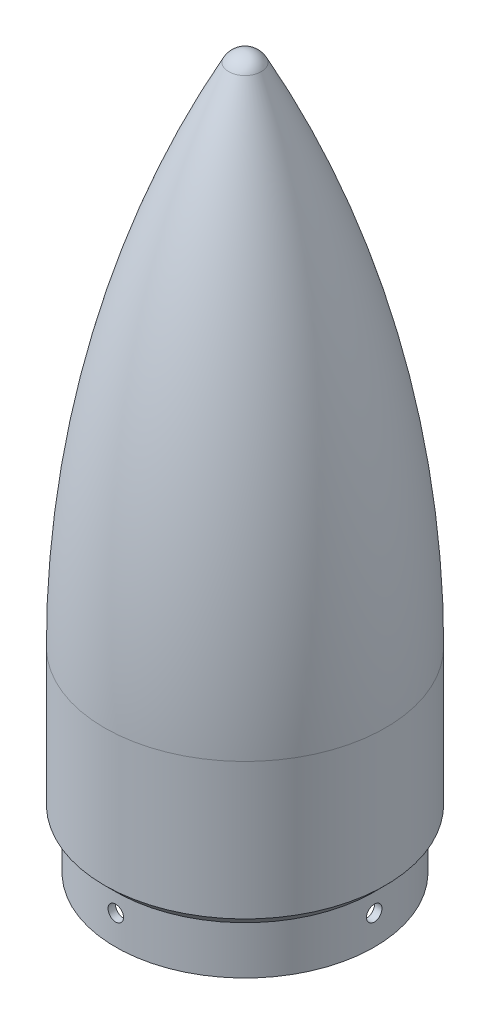
from build123d import *

# Parameters (mm, degrees)
SKETCH2_R           = 38.1
BOSS_EXTRUDE1_DEPTH = 40
SKETCH3_R           = 35.1
BOSS_EXTRUDE2_DEPTH = 13
CHAMFER1_SIZE       = 3
SKETCH4_R           = 2.1
CUT_EXTRUDE1_DEPTH  = 151.010733
CIRPATTERN1_COUNT   = 2
CIRPATTERN1_ANGLE   = 90


# Read off the part's stored shape, not the designer's step: Shell1
with BuildPart() as part:
    # Sketch1 → Revolve1 (revolve)
    with BuildSketch(Plane.XY, mode=Mode.PRIVATE) as revolve1_sk:
        with BuildLine():
            Line((0, 0), (-38.1, 0))
            ThreePointArc((-38.1, 0), (-29.56040295, 70.689958057), (-4.432931983, 137.312815175))
            ThreePointArc((-4.432931983, 137.312815175), (-2.591903174, 139.275749985), (0, 140))
            Line((0, 140), (0, 0))
        make_face()
    revolve(revolve1_sk.sketch.rotate(Axis((0, 140, 0), (0, -1, 0)), 270), axis=Axis((0, 140, 0), (0, -1, 0)))

    # Sketch2 → Boss-Extrude1 (add)
    with BuildSketch(Plane.XZ):
        with Locations(Location((0, 0, 0), (0, 0, 270))):
            Circle(SKETCH2_R)
    extrude(amount=BOSS_EXTRUDE1_DEPTH)

    # Sketch3 → Boss-Extrude2 (add)
    with BuildSketch(Plane.XZ.offset(40)):
        with Locations(Location((0, 0, 0), (0, 0, 90))):
            Circle(SKETCH3_R)
    extrude(amount=BOSS_EXTRUDE2_DEPTH)

    # Chamfer1
    chamfer1_edges = [part.edges().sort_by_distance(p)[0] for p in [
        (0, -40, 38.1),
    ]]
    chamfer(chamfer1_edges, length=CHAMFER1_SIZE - 0.0001)  # a hair under: the kernel refuses the full size

    # Shell1 outline → Shell1 (revolve, cut)
    with BuildSketch(Plane.XY):
        with BuildLine():
            ThreePointArc((2.659759191, 136.387689102), (1.555141906, 137.56544999), (0, 138))
            Line((0, 138), (0, -53))
            Line((0, -53), (33.1, -53))
            Line((33.1, -53), (33.1, -39.171572875))
            Line((33.1, -39.171572875), (36.1, -36.171572875))
            Line((36.1, -36.171572875), (36.1, 0))
            ThreePointArc((36.1, 0), (27.617937302, 70.213694256), (2.659759191, 136.387689102))
        make_face()
    revolve(axis=Axis((0, 0, 0), (0, 1, 0)), mode=Mode.SUBTRACT)

    # Sketch4 → Cut-Extrude1 (cut, symmetric)
    with BuildSketch(Plane.XY):
        with Locations((0, -45)):
            Circle(SKETCH4_R)
    cut_extrude1 = extrude(amount=CUT_EXTRUDE1_DEPTH, both=True, mode=Mode.SUBTRACT)

    # CirPattern1: Cut-Extrude1 ×2 about axis
    cirpattern1_axis = Axis((0, -53, 0), (0, 1, 0))
    for i in range(1, CIRPATTERN1_COUNT):
        add(cut_extrude1.rotate(cirpattern1_axis, i * CIRPATTERN1_ANGLE / (CIRPATTERN1_COUNT - 1)), mode=Mode.SUBTRACT)


solid = part.part
